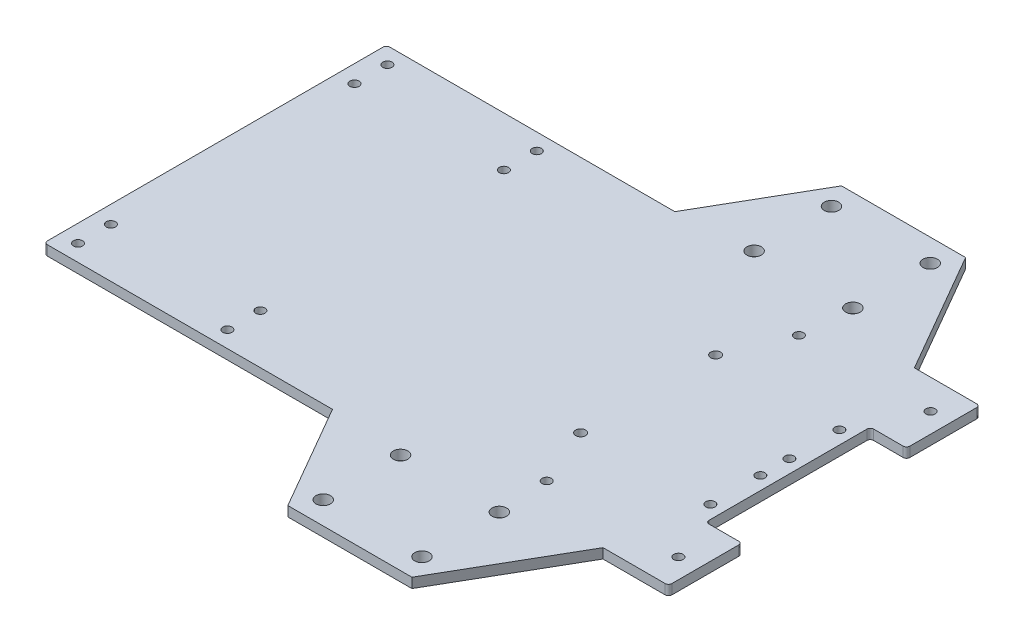
from build123d import *

# Parameters (mm, degrees)
BOSS_EXTRUDE1_DEPTH      = 3
SKETCH2_R                = 1.4
MOTOR_CLEVIS_HOLES_DEPTH = 204.240768548
SKETCH3_R                = 1.4
SERVO_CLEVIS_HOLES_DEPTH = 204.240768548
SKETCH4_R                = 1.5
BUCKET_HOLE_DEPTH        = 204.240768548
SKETCH5_R                = 2.2
CASTER_HOLES_DEPTH       = 204.240768548
SKETCH6_R                = 1.4
SKETCH6_W                = 11
SKETCH6_H                = 50
COLOR_SENSOR_HOLES_DEPTH = 204.240768548
FILLET2_R                = 1


with BuildPart() as part:
    # Sketch1 → Boss-Extrude1 (new body)
    with BuildSketch(Plane(origin=(0, 0, 0), x_dir=(1, 0, 0), z_dir=(0, 1, 0))):
        Polygon((0, 52), (0, -52), (87.617056359, -52), (106.15, -84.1), (143.85, -84.1), (165.096489906, -47.3), (185, -47.3), (185, 47.3), (165.096489906, 47.3), (143.85, 84.1), (106.15, 84.1), (87.617056359, 52), align=None)
    extrude(amount=BOSS_EXTRUDE1_DEPTH)

    # Sketch2 → Motor Clevis Holes (cut, through all)
    with BuildSketch(Plane(origin=(0, 3, 0), x_dir=(1, 0, 0), z_dir=(0, 1, 0))):
        with Locations((5.3, 47)):
            Circle(SKETCH2_R)
        with Locations((5.3, 37)):
            Circle(SKETCH2_R)
        with Locations((50.7, 47)):
            Circle(SKETCH2_R)
        with Locations((50.7, 37)):
            Circle(SKETCH2_R)
    motor_clevis_holes = extrude(amount=-MOTOR_CLEVIS_HOLES_DEPTH, mode=Mode.SUBTRACT)

    # Motor Clevis Holes Mirror: Motor Clevis Holes across plane
    add(motor_clevis_holes.mirror(Plane.XY), mode=Mode.SUBTRACT)

    # Sketch3 → Servo Clevis Holes (cut, through all)
    with BuildSketch(Plane(origin=(0, 3, 0), x_dir=(1, 0, 0), z_dir=(0, 1, 0))):
        with Locations((179, -38.3)):
            Circle(SKETCH3_R)
        with Locations((139, -38.3)):
            Circle(SKETCH3_R)
    servo_clevis_holes = extrude(amount=-SERVO_CLEVIS_HOLES_DEPTH, mode=Mode.SUBTRACT)

    # Servo Clevis Holes Mirror: Servo Clevis Holes across plane
    add(servo_clevis_holes.mirror(Plane.XY), mode=Mode.SUBTRACT)

    # Sketch4 → Bucket Hole (cut, through all)
    with BuildSketch(Plane(origin=(0, 3, 0), x_dir=(1, 0, 0), z_dir=(0, 1, 0))):
        with Locations((131.5, -20.5)):
            Circle(SKETCH4_R)
    bucket_hole = extrude(amount=-BUCKET_HOLE_DEPTH, mode=Mode.SUBTRACT)

    # Bucket Hole Mirror: Bucket Hole across plane
    add(bucket_hole.mirror(Plane.XY), mode=Mode.SUBTRACT)

    # Sketch5 → Caster Holes (cut, through all)
    with BuildSketch(Plane(origin=(0, 3, 0), x_dir=(1, 0, 0), z_dir=(0, 1, 0))):
        with Locations((110, -53.7)):
            Circle(SKETCH5_R)
        with Locations((110, -77.2)):
            Circle(SKETCH5_R)
        with Locations((140, -77.2)):
            Circle(SKETCH5_R)
        with Locations((140, -53.7)):
            Circle(SKETCH5_R)
    caster_holes = extrude(amount=-CASTER_HOLES_DEPTH, mode=Mode.SUBTRACT)

    # Caster Holes Mirror: Caster Holes across plane
    add(caster_holes.mirror(Plane.XY), mode=Mode.SUBTRACT)

    # Sketch6 → Color Sensor Holes (cut, through all)
    with BuildSketch(Plane(origin=(0, 3, 0), x_dir=(1, 0, 0), z_dir=(0, 1, 0))):
        with Locations((170, 4.4)):
            Circle(SKETCH6_R)
        with Locations((170, 19.6)):
            Circle(SKETCH6_R)
        with Locations((170, -4.4)):
            Circle(SKETCH6_R)
        with Locations((170, -19.6)):
            Circle(SKETCH6_R)
        with Locations((179.5, 0)):
            Rectangle(SKETCH6_W, SKETCH6_H)
    extrude(amount=-COLOR_SENSOR_HOLES_DEPTH, mode=Mode.SUBTRACT)

    # Fillet2
    fillet2_edges = [part.edges().sort_by_distance(p)[0] for p in [
        (185, 1.5, 47.3),
        (185, 1.5, 25),
        (174, 1.5, 25),
        (174, 1.5, -25),
        (185, 1.5, -25),
        (185, 1.5, -47.3),
        (0, 1.5, -52),
        (0, 1.5, 52),
    ]]
    fillet(fillet2_edges, radius=FILLET2_R)


solid = part.part
